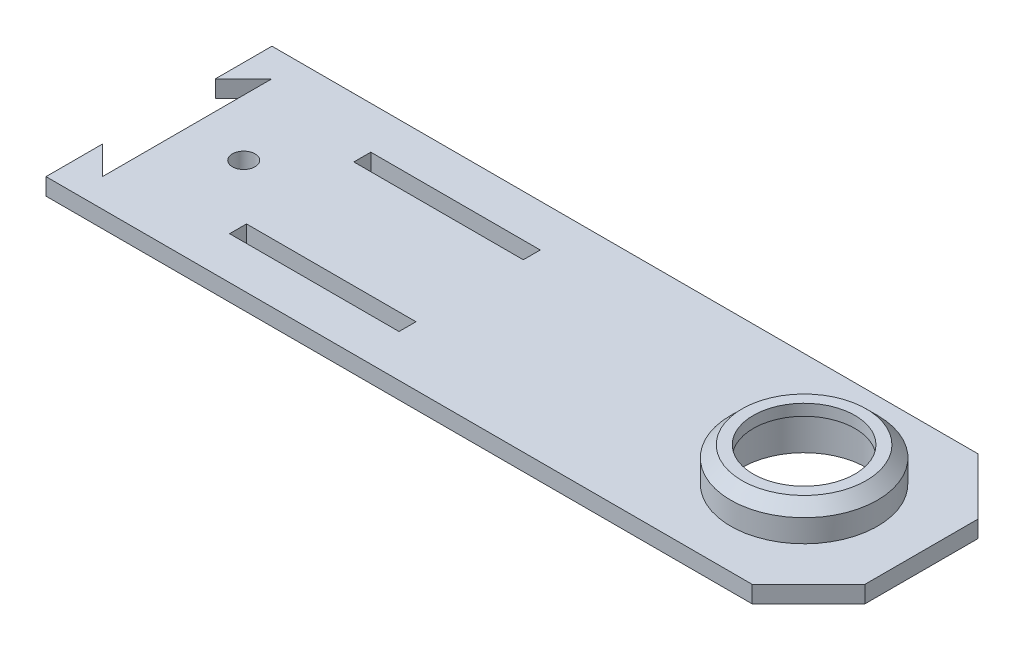
from build123d import *

# Parameters (mm, degrees)
CROQUIS1_R              = 11
CROQUIS1_R_2            = 2
CROQUIS1_W              = 30
CROQUIS1_H              = 3
SALIENTE_EXTRUIR1_DEPTH = 3
CROQUIS2_R              = 13
CROQUIS2_R_2            = 11
SALIENTE_EXTRUIR2_DEPTH = 4
CROQUIS3_R              = 13
CROQUIS3_R_2            = 9
SALIENTE_EXTRUIR3_DEPTH = 2
CHAFL_N1_SIZE           = 2
CHAFL_N2_SIZE           = 10


with BuildPart() as part:
    # Croquis1 → Saliente-Extruir1 (new body)
    with BuildSketch(Plane(origin=(0, 0, 0), x_dir=(1, 0, 0), z_dir=(0, 1, 0))):
        Polygon((-67.5, 10), (-62.5, 15), (-62.5, -15), (-67.5, -10), (-67.5, -20), (67.5, -20), (67.5, 20), (-67.5, 20), align=None)
        with Locations((46.713951104, 0)):
            Circle(CROQUIS1_R, mode=Mode.SUBTRACT)
        with Locations((-52.5, 0)):
            Circle(CROQUIS1_R_2, mode=Mode.SUBTRACT)
        with Locations((-27.5, 11)):
            Rectangle(CROQUIS1_W, CROQUIS1_H, mode=Mode.SUBTRACT)
        with Locations((-27.5, -11)):
            Rectangle(CROQUIS1_W, CROQUIS1_H, mode=Mode.SUBTRACT)
    extrude(amount=SALIENTE_EXTRUIR1_DEPTH)

    # Croquis2 → Saliente-Extruir2 (add)
    with BuildSketch(Plane(origin=(0, 3, 0), x_dir=(1, 0, 0), z_dir=(0, 1, 0))):
        with Locations((46.713951104, 0)):
            Circle(CROQUIS2_R)
        with Locations((46.713951104, 0)):
            Circle(CROQUIS2_R_2, mode=Mode.SUBTRACT)
    extrude(amount=SALIENTE_EXTRUIR2_DEPTH)

    # Croquis3 → Saliente-Extruir3 (add)
    with BuildSketch(Plane(origin=(0, 7, 0), x_dir=(1, 0, 0), z_dir=(0, 1, 0))):
        with Locations((46.713951104, 0)):
            Circle(CROQUIS3_R)
        with Locations((46.713951104, 0)):
            Circle(CROQUIS3_R_2, mode=Mode.SUBTRACT)
    extrude(amount=SALIENTE_EXTRUIR3_DEPTH)

    # Chaflán1
    chafl_n1_edges = [part.edges().sort_by_distance(p)[0] for p in [
        (33.713951104, 9, 0),
    ]]
    chamfer(chafl_n1_edges, length=CHAFL_N1_SIZE)

    # Chaflán2
    chafl_n2_edges = [part.edges().sort_by_distance(p)[0] for p in [
        (67.5, 1.5, -20),
        (67.5, 1.5, 20),
    ]]
    chamfer(chafl_n2_edges, length=CHAFL_N2_SIZE)


solid = part.part
